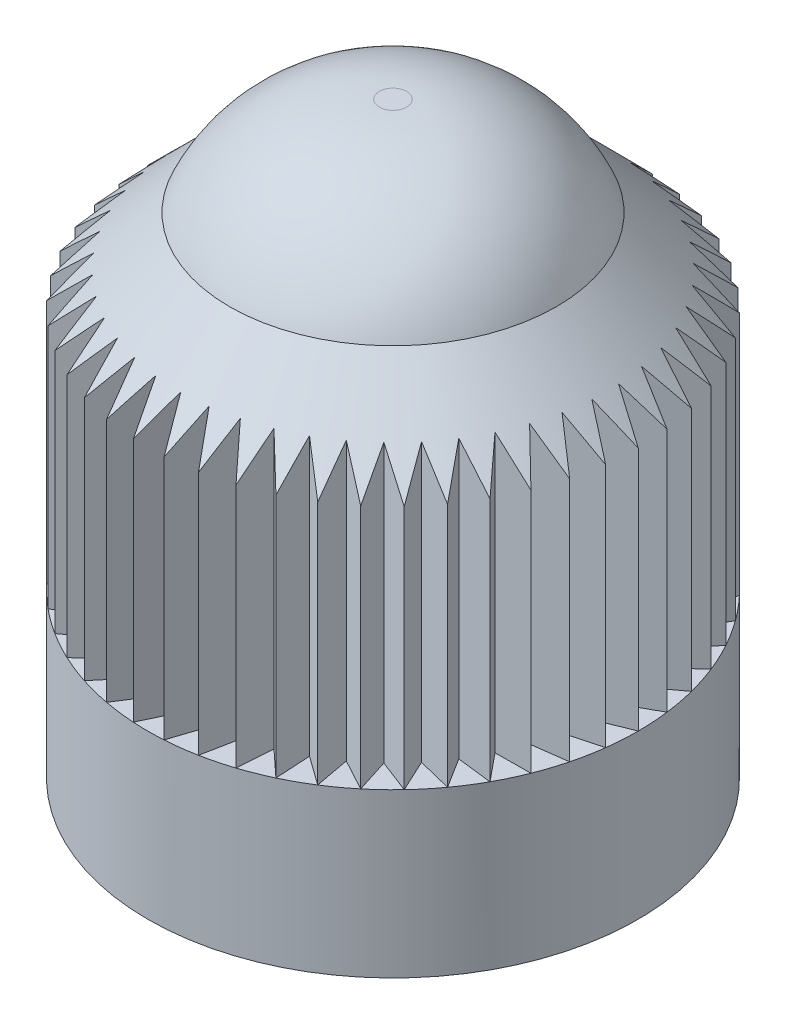
from build123d import *

# Parameters (mm, degrees)
SKETCH1_R           = 7.5
BOSS_EXTRUDE1_DEPTH = 18
SKETCH2_R           = 6.5
CUT_EXTRUDE1_DEPTH  = 0.01
CUT_EXTRUDE2_DEPTH  = 14
CHAMFER1_SIZE       = 0.577350269
CHAMFER1_SIZE_2     = 1
SKETCH4_OUTSIDE_W   = 22.564
SKETCH4_OUTSIDE_H   = 22.564
SKETCH4_OUTSIDE_R   = 5
CUT_EXTRUDE3_DEPTH  = 13
CHAMFER2_SIZE       = 10
SKETCH5_OUTSIDE_W   = 22.564
SKETCH5_OUTSIDE_H   = 22.564
CUT_EXTRUDE4_DEPTH  = 13
FILLET1_R           = 5
SKETCH6_R           = 12.617301908
CUT_EXTRUDE5_DEPTH  = 10
CHAMFER3_SIZE       = 0.5
CHAMFER3_SIZE2      = 1.37373871


with BuildPart() as part:
    # Sketch1 → Boss-Extrude1 (new body)
    with BuildSketch(Plane(origin=(0, 0, 0), x_dir=(1, 0, 0), z_dir=(0, 1, 0))):
        with Locations(Location((0, 0, 0), (0, 0, 270))):
            Circle(SKETCH1_R)
    extrude(amount=BOSS_EXTRUDE1_DEPTH)

    # Sketch2 → Cut-Extrude1 (cut)
    with BuildSketch(Plane.XZ):
        with Locations(Location((0, 0, 0), (0, 0, 270))):
            Circle(SKETCH2_R)
    extrude(amount=-CUT_EXTRUDE1_DEPTH, mode=Mode.SUBTRACT)

    # Sketch3 → Cut-Extrude2 (cut)
    with BuildSketch(Plane.XZ.offset(-0.01)):
        with BuildLine():
            Line((-1.742630012, -2.683885363), (3.136279729, -0.635412826))
            ThreePointArc((3.136279729, -0.635412826), (-1.238799749, 2.950487279), (-1.742630012, -2.683885363))
        make_face()
    extrude(amount=-CUT_EXTRUDE2_DEPTH, mode=Mode.SUBTRACT)

    # Chamfer1
    # the kernel refuses this chamfer: 1, 0.577350269 mm, written as the material it takes off along each edge
    with BuildSketch(Plane(origin=(0, 0, 0), x_dir=(0, 0, -1), z_dir=(-1, 0, 0))) as chamfer1_piece_1_section:
        Polygon((6.5 + CHAMFER1_SIZE, 0), (6.5, -CHAMFER1_SIZE_2), (6.5, 0), align=None)
    chamfer1_piece_1 = revolve(axis=Axis((0, 0, 0), (0, -1, 0)), mode=Mode.PRIVATE)
    chamfer1_piece_1 = split(chamfer1_piece_1, bisect_by=Plane(origin=(0, 0.01, 7.069044644), z_dir=(0, -1, 0)), keep=Keep.TOP, mode=Mode.PRIVATE)
    add(chamfer1_piece_1, mode=Mode.SUBTRACT)

    # Sketch4 outside → Cut-Extrude3 (cut)
    with BuildSketch(Plane(origin=(0, 18, 0), x_dir=(1, 0, 0), z_dir=(0, 1, 0))):
        Rectangle(SKETCH4_OUTSIDE_W, SKETCH4_OUTSIDE_H)
        with Locations(Location((0, 0, 0), (0, 0, 270))):
            Circle(SKETCH4_OUTSIDE_R, mode=Mode.SUBTRACT)
    extrude(amount=-CUT_EXTRUDE3_DEPTH, mode=Mode.SUBTRACT)

    # Chamfer2
    # the kernel refuses this chamfer: 10 mm, written as the material it adds along each edge
    with BuildSketch(Plane(origin=(0, 5, 0), x_dir=(0, 0, 1), z_dir=(-1, 0, 0))) as chamfer2_piece_1_section:
        Polygon((5 + CHAMFER2_SIZE, 0), (5, CHAMFER2_SIZE), (5, 0), align=None)
    chamfer2_piece_1 = revolve(axis=Axis((0, 5, 0), (0, 1, 0)), mode=Mode.PRIVATE)
    chamfer2_piece_1 = chamfer2_piece_1 & Plane(origin=(0, 13.822029982, 0), x_dir=(0, 0, 1), z_dir=(0, -1, 0)) * Cylinder(7.5, 60, mode=Mode.PRIVATE)
    add(chamfer2_piece_1)

    # Sketch5 outside → Cut-Extrude4 (cut)
    with BuildSketch(Plane(origin=(0, 18, 0), x_dir=(1, 0, 0), z_dir=(0, 1, 0))):
        Rectangle(SKETCH5_OUTSIDE_W, SKETCH5_OUTSIDE_H)
        Polygon((2.39855852, -6.041267833), (2.324412885, -7.130715584), (1.622473538, -6.294249727), (1.412368553, -7.365813945), (0.820801178, -6.447967542), (0.478050326, -7.48474902), (0.006184294, -6.499997058), (-0.463807041, -7.485645131), (-0.808530121, -6.449517737), (-1.398349893, -7.368488147), (-1.610493532, -6.297325669), (-2.310839933, -7.135125704), (-2.387058499, -6.045821013), (-3.186886646, -6.789238065), (-3.125978127, -5.698970148), (-4.012674253, -6.336280087), (-3.815599212, -5.26224312), (-4.77517959, -5.783395187), (-4.445046019, -4.742527374), (-5.462377492, -5.139302689), (-5.004391794, -4.148019138), (-6.063430439, -4.414160318), (-5.484815322, -3.488094163), (-6.568859465, -3.619404003), (-5.878740035, -2.773159859), (-6.970693653, -2.767567523), (-6.179953506, -2.014491167), (-7.262595838, -1.872084851), (-6.383705419, -1.224052746), (-7.439962549, -0.947078282), (-6.486782484, -0.414310283), (-7.499996605, -0.007135723), (-6.487559114, 0.401966102), (-7.441751235, 0.93291937), (-6.386023061, 1.211903241), (-7.266145003, 1.858261768), (-6.18377561, 2.002727942), (-6.975947323, 2.754298268), (-5.884006323, 2.761968426), (-6.575734787, 3.606897838), (-5.491442742, 3.477651019), (-6.071818985, 4.402614475), (-5.012275828, 4.138488978), (-5.47214697, 5.128899252), (-4.454062331, 4.734060493), (-4.786175929, 5.774298224), (-3.825605609, 5.254973047), (-4.024724034, 6.328633063), (-3.136816802, 5.693011536), (-3.199799837, 6.783161579), (-2.39855852, 6.041267833), (-2.324412885, 7.130715584), (-1.622473538, 6.294249727), (-1.412368553, 7.365813945), (-0.820801178, 6.447967542), (-0.478050326, 7.48474902), (-0.006184294, 6.499997058), (0.463807041, 7.485645131), (0.808530121, 6.449517737), (1.398349893, 7.368488147), (1.610493532, 6.297325669), (2.310839933, 7.135125704), (2.387058499, 6.045821013), (3.186886646, 6.789238065), (3.125978127, 5.698970148), (4.012674253, 6.336280087), (3.815599212, 5.26224312), (4.77517959, 5.783395187), (4.445046019, 4.742527374), (5.462377492, 5.139302689), (5.004391794, 4.148019138), (6.063430439, 4.414160318), (5.484815322, 3.488094163), (6.568859465, 3.619404003), (5.878740035, 2.773159859), (6.970693653, 2.767567523), (6.179953506, 2.014491167), (7.262595838, 1.872084851), (6.383705419, 1.224052746), (7.439962549, 0.947078282), (6.486782484, 0.414310283), (7.499996605, 0.007135723), (6.487559114, -0.401966102), (7.441751235, -0.93291937), (6.386023061, -1.211903241), (7.266145003, -1.858261768), (6.18377561, -2.002727942), (6.975947323, -2.754298268), (5.884006323, -2.761968426), (6.575734787, -3.606897838), (5.491442742, -3.477651019), (6.071818985, -4.402614475), (5.012275828, -4.138488978), (5.47214697, -5.128899252), (4.454062331, -4.734060493), (4.786175929, -5.774298224), (3.825605609, -5.254973047), (4.024724034, -6.328633063), (3.136816802, -5.693011536), (3.199799837, -6.783161579), align=None, mode=Mode.SUBTRACT)
    extrude(amount=-CUT_EXTRUDE4_DEPTH, mode=Mode.SUBTRACT)

    # Fillet1
    # the kernel refuses this fillet: 5 mm, written as the material it takes off along each edge
    with BuildSketch(Plane(origin=(0, 18, 0), x_dir=(0, 0, 1), z_dir=(-1, 0, 0))) as fillet1_piece_1:
        with BuildLine():
            CenterArc((0.417424305, -5), FILLET1_R, 23.578178478, 66.421821522)
            Line((0.417424305, 0), (0.417424305, 0.1))
            Line((0.417424305, 0.1), (5, 0.1))
            Line((5, 0.1), (5.1, 0))
            ThreePointArc((5.1, 0), (5.1, -1.5), (5.091651514, -2.96))
            Line((5.091651514, -2.96), (5, -3))
        make_face()
    revolve(axis=Axis((0, 18, 0), (0, 1, 0)), mode=Mode.SUBTRACT)

    # Sketch6 → Cut-Extrude5 (cut)
    with BuildSketch(Plane.XZ.offset(-0.01)):
        Circle(SKETCH6_R)
    extrude(amount=CUT_EXTRUDE5_DEPTH, mode=Mode.SUBTRACT)

    # Chamfer3
    chamfer3_edges = [part.edges().sort_by_distance(p)[0] for p in [
        (-1.238799749, 0.01, 2.950487279),
        (0.696824859, 0.01, -1.659649094),
    ]]
    chamfer3_side = [part.faces().sort_by_distance(p)[0] for p in [
        (0, 0.01, -7.287867966),
    ]]
    chamfer(chamfer3_edges, length=CHAMFER3_SIZE, length2=CHAMFER3_SIZE2, reference=chamfer3_side[0])


solid = part.part
